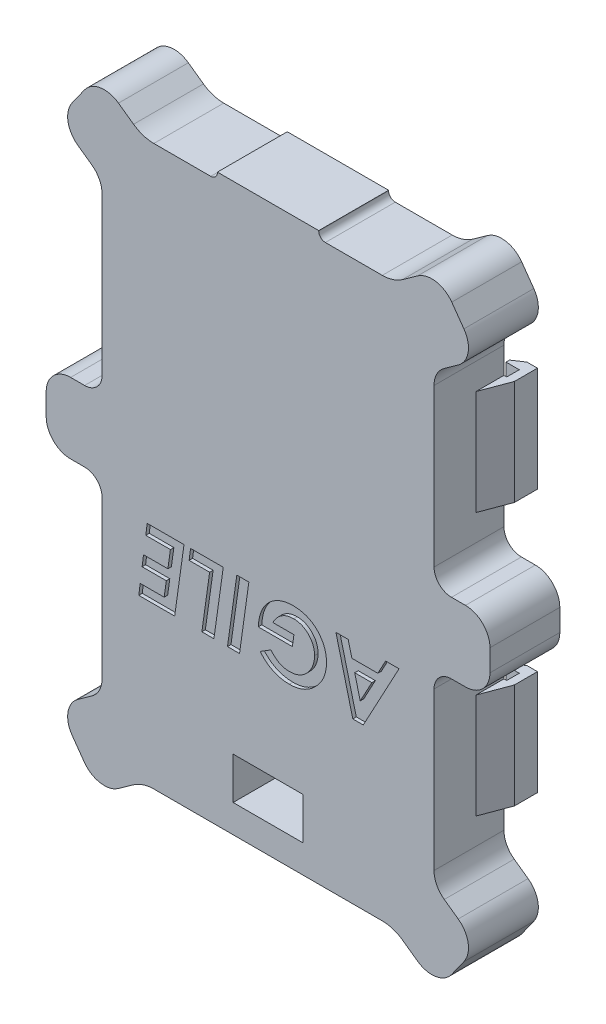
from build123d import *

# Parameters (mm, degrees)
EXTRUDE_3_DEPTH      = 18
SKETCH1_W            = 24
SKETCH1_H            = 15
SKETCH1_W_2          = 20
SKETCH1_H_2          = 12
EXTRUDE_3_2_DEPTH    = 18
SKETCH_1_W           = 20
SKETCH_1_H           = 12
EXTRUDE_4_DEPTH      = 2
SKETCH_2_W           = 24
SKETCH_2_H           = 15
SKETCH_2_W_2         = 20
SKETCH_2_H_2         = 12
CUT_EXTRUDE_1_DEPTH  = 6
SKETCH_3_W           = 34
SKETCH_3_H           = 4.2
CUT_EXTRUDE_2_DEPTH  = 1.5
CUT_EXTRUDE_3_DEPTH  = 1
EXTRUDE_5_DEPTH      = 3
EXTRUDE_6_DEPTH      = 3
EXTRUDE_7_DEPTH      = 3
SKETCH_10_W          = 3
SKETCH_10_H          = 30
EXTRUDE_8_DEPTH      = 3
SKETCH_11_W          = 0.8
SKETCH_11_H          = 3.6
CUT_EXTRUDE_5_DEPTH  = 30
EXTRUDE_9_DEPTH      = 3
SKETCH_14_W          = 3
SKETCH_14_H          = 3
EXTRUDE_10_DEPTH     = 30
EXTRUDE_11_DEPTH     = 3
SKETCH_17_W          = 3
SKETCH_17_H          = 3
EXTRUDE_12_DEPTH     = 30
FILLET_1_R           = 1.5
SKETCH_8_W           = 0.8
SKETCH_8_H           = 3.6
CUT_EXTRUDE_9_DEPTH  = 30
SKETCH_15_W          = 0.8
SKETCH_15_H          = 3.6
CUT_EXTRUDE_10_DEPTH = 30
SKETCH_18_W          = 0.8
SKETCH_18_H          = 3.6
CUT_EXTRUDE_11_DEPTH = 30


with BuildPart() as part:
    # Sketch1 → Бобышка-Вытянуть3 (new body)
    with BuildSketch(Plane.XY):
        with BuildLine():
            ThreePointArc((-18.691989124, 16.827995472), (-21.740151192, 17.303883544), (-24.498196466, 18.686253871))
            Line((-24.498196466, 18.686253871), (-28.812938034, 21.763271713))
            ThreePointArc((-28.812938034, 21.763271713), (-34.033313652, 22.967935089), (-38.576502294, 20.128397731))
            Line((-38.576502294, 20.128397731), (-42.0602267, 15.24335277))
            ThreePointArc((-42.0602267, 15.24335277), (-43.264890076, 10.022977152), (-40.425352718, 5.47978851))
            Line((-40.425352718, 5.47978851), (-36.440527218, 2.638047245))
            ThreePointArc((-36.440527218, 2.638047245), (-34.281914219, 0.144259766), (-33.504872357, -3.061171876))
            Line((-33.504872357, -3.061171876), (-33.504872357, -48.061171876))
            ThreePointArc((-33.504872357, -48.061171876), (-34.969338451, -51.596705782), (-38.504872357, -53.061171876))
            Line((-38.504872357, -53.061171876), (-42.504872357, -53.061171876))
            ThreePointArc((-42.504872357, -53.061171876), (-47.454619825, -55.111424408), (-49.504872357, -60.061171876))
            Line((-49.504872357, -60.061171876), (-49.504872357, -66.28283718))
            ThreePointArc((-49.504872357, -66.28283718), (-47.454619825, -71.232584649), (-42.504872357, -73.28283718))
            Line((-42.504872357, -73.28283718), (-38.504872357, -73.28283718))
            ThreePointArc((-38.504872357, -73.28283718), (-34.969338451, -74.747303275), (-33.504872357, -78.28283718))
            Line((-33.504872357, -78.28283718), (-33.504872357, -123.28283718))
            ThreePointArc((-33.504872357, -123.28283718), (-34.281914219, -126.488268823), (-36.440527218, -128.982056301))
            Line((-36.440527218, -128.982056301), (-40.425352718, -131.823797566))
            ThreePointArc((-40.425352718, -131.823797566), (-43.264890076, -136.366986209), (-42.0602267, -141.587361827))
            Line((-42.0602267, -141.587361827), (-38.576502537, -146.472406448))
            ThreePointArc((-38.576502537, -146.472406448), (-34.033313895, -149.311943805), (-28.812938276, -148.107280429))
            Line((-28.812938276, -148.107280429), (-24.495675072, -145.028464305))
            ThreePointArc((-24.495675072, -145.028464305), (-21.738676476, -143.647420254), (-18.691989124, -143.172004528))
            Line((-18.691989124, -143.172004528), (46.687073776, -143.172004528))
            ThreePointArc((46.687073776, -143.172004528), (49.735235844, -143.647892601), (52.493281118, -145.030262927))
            Line((52.493281118, -145.030262927), (56.808022686, -148.107280769))
            ThreePointArc((56.808022686, -148.107280769), (62.028398304, -149.311944145), (66.571586947, -146.472406787))
            Line((66.571586947, -146.472406787), (70.055311352, -141.587361827))
            ThreePointArc((70.055311352, -141.587361827), (71.259974728, -136.366986209), (68.42043737, -131.823797566))
            Line((68.42043737, -131.823797566), (64.43561187, -128.982056301))
            ThreePointArc((64.43561187, -128.982056301), (62.276998871, -126.488268823), (61.499957009, -123.28283718))
            Line((61.499957009, -123.28283718), (61.499957009, -78.28283718))
            ThreePointArc((61.499957009, -78.28283718), (62.964423103, -74.747303275), (66.499957009, -73.282837181))
            Line((66.499957009, -73.282837181), (70.499957009, -73.282837181))
            ThreePointArc((70.499957009, -73.282837181), (75.449704477, -71.232584649), (77.499957009, -66.282837181))
            Line((77.499957009, -66.282837181), (77.499957009, -60.061171876))
            ThreePointArc((77.499957009, -60.061171876), (75.449704477, -55.111424408), (70.499957009, -53.061171876))
            Line((70.499957009, -53.061171876), (66.499957009, -53.061171876))
            ThreePointArc((66.499957009, -53.061171876), (62.964423103, -51.596705782), (61.499957009, -48.061171876))
            Line((61.499957009, -48.061171876), (61.499957009, -3.061171876))
            ThreePointArc((61.499957009, -3.061171876), (62.276998871, 0.144259766), (64.43561187, 2.638047245))
            Line((64.43561187, 2.638047245), (68.42043737, 5.47978851))
            ThreePointArc((68.42043737, 5.47978851), (71.259974728, 10.022977152), (70.055311352, 15.24335277))
            Line((70.055311352, 15.24335277), (66.571586946, 20.128397731))
            ThreePointArc((66.571586946, 20.128397731), (62.028398304, 22.967935089), (56.808022686, 21.763271712))
            Line((56.808022686, 21.763271712), (52.493281118, 18.68625387))
            ThreePointArc((52.493281118, 18.68625387), (49.735235844, 17.303883544), (46.687073776, 16.827995472))
            Line((46.687073776, 16.827995472), (30.397542326, 16.827995472))
            ThreePointArc((30.397542326, 16.827995472), (29.054039442, 17.384492587), (28.497542326, 18.727995472))
            Line((28.497542326, 18.727995472), (28.497542326, 18.827995472))
            Line((28.497542326, 18.827995472), (-0.502457674, 18.827995472))
            Line((-0.502457674, 18.827995472), (-0.502457674, 18.727995472))
            ThreePointArc((-0.502457674, 18.727995472), (-1.05895479, 17.384492588), (-2.402457674, 16.827995472))
            Line((-2.402457674, 16.827995472), (-18.691989124, 16.827995472))
        make_face()
        with BuildLine():
            ThreePointArc((-38.504872357, -54.561171876), (-33.908678279, -52.657365954), (-32.004872357, -48.061171876))
            Line((-32.004872357, -48.061171876), (-32.004872357, -3.061171876))
            ThreePointArc((-32.004872357, -3.061171876), (-32.948423189, 0.831137975), (-35.569596116, 3.859308485))
            Line((-35.569596116, 3.859308485), (-39.554421617, 6.70104975))
            ThreePointArc((-39.554421617, 6.70104975), (-41.785486683, 10.270697969), (-40.838965459, 14.372421669))
            Line((-40.838965459, 14.372421669), (-37.355241054, 19.25746663))
            ThreePointArc((-37.355241054, 19.25746663), (-33.785592835, 21.488531696), (-29.683869135, 20.542010472))
            Line((-29.683869135, 20.542010472), (-25.369127567, 17.46499263))
            ThreePointArc((-25.369127567, 17.46499263), (-22.197375502, 15.875266755), (-18.691989124, 15.327995472))
            Line((-18.691989124, 15.327995472), (0.997542326, 15.327995472))
            Line((0.997542326, 15.327995472), (0.997542326, 17.327995472))
            Line((0.997542326, 17.327995472), (26.997542326, 17.327995472))
            Line((26.997542326, 17.327995472), (26.997542326, 15.327995472))
            Line((26.997542326, 15.327995472), (46.687073776, 15.327995472))
            ThreePointArc((46.687073776, 15.327995472), (50.192460154, 15.875266755), (53.364212219, 17.46499263))
            Line((53.364212219, 17.46499263), (57.678953788, 20.542010472))
            ThreePointArc((57.678953788, 20.542010472), (61.780677487, 21.488531696), (65.350325706, 19.25746663))
            Line((65.350325706, 19.25746663), (68.834050111, 14.372421669))
            ThreePointArc((68.834050111, 14.372421669), (69.780571336, 10.270697969), (67.549506269, 6.70104975))
            Line((67.549506269, 6.70104975), (63.564680768, 3.859308485))
            ThreePointArc((63.564680768, 3.859308485), (60.943507842, 0.831137975), (59.999957009, -3.061171876))
            Line((59.999957009, -3.061171876), (59.999957009, -48.061171876))
            ThreePointArc((59.999957009, -48.061171876), (61.903762931, -52.657365954), (66.499957009, -54.561171876))
            Line((66.499957009, -54.561171876), (70.499957009, -54.561171876))
            ThreePointArc((70.499957009, -54.561171876), (74.389044306, -56.172084579), (75.999957009, -60.061171876))
            Line((75.999957009, -60.061171876), (75.999957009, -66.282837181))
            ThreePointArc((75.999957009, -66.282837181), (74.389044306, -70.171924477), (70.499957009, -71.782837181))
            Line((70.499957009, -71.782837181), (66.499957009, -71.782837181))
            ThreePointArc((66.499957009, -71.782837181), (61.903762932, -73.686643103), (59.999957009, -78.28283718))
            Line((59.999957009, -78.28283718), (59.999957009, -123.28283718))
            ThreePointArc((59.999957009, -123.28283718), (60.943507842, -127.175147032), (63.564680769, -130.203317542))
            Line((63.564680769, -130.203317542), (67.549506269, -133.045058807))
            ThreePointArc((67.549506269, -133.045058807), (69.780571336, -136.614707025), (68.834050112, -140.716430725))
            Line((68.834050112, -140.716430725), (65.350325706, -145.601475686))
            ThreePointArc((65.350325706, -145.601475686), (61.780677488, -147.832540753), (57.678953788, -146.886019529))
            Line((57.678953788, -146.886019529), (53.364212219, -143.809001687))
            ThreePointArc((53.364212219, -143.809001687), (50.192460155, -142.219275812), (46.687073776, -141.672004528))
            Line((46.687073776, -141.672004528), (-18.695087599, -141.672004528))
            ThreePointArc((-18.695087599, -141.672004528), (-22.19752364, -142.218815196), (-25.366606173, -143.807203065))
            Line((-25.366606173, -143.807203065), (-29.683869378, -146.886019189))
            ThreePointArc((-29.683869378, -146.886019189), (-33.785593078, -147.832540413), (-37.355241297, -145.601475346))
            Line((-37.355241297, -145.601475346), (-40.838965459, -140.716430725))
            ThreePointArc((-40.838965459, -140.716430725), (-41.785486683, -136.614707025), (-39.554421617, -133.045058807))
            Line((-39.554421617, -133.045058807), (-35.569596116, -130.203317542))
            ThreePointArc((-35.569596116, -130.203317542), (-32.948423189, -127.175147032), (-32.004872357, -123.28283718))
            Line((-32.004872357, -123.28283718), (-32.004872357, -78.28283718))
            ThreePointArc((-32.004872357, -78.28283718), (-33.908678279, -73.686643103), (-38.504872357, -71.78283718))
            Line((-38.504872357, -71.78283718), (-42.504872357, -71.78283718))
            ThreePointArc((-42.504872357, -71.78283718), (-46.393959654, -70.171924477), (-48.004872357, -66.28283718))
            Line((-48.004872357, -66.28283718), (-48.004872357, -60.061171876))
            ThreePointArc((-48.004872357, -60.061171876), (-46.393959654, -56.172084579), (-42.504872357, -54.561171876))
            Line((-42.504872357, -54.561171876), (-38.504872357, -54.561171876))
        make_face(mode=Mode.SUBTRACT)
    extrude(amount=EXTRUDE_3_DEPTH)



with BuildPart() as body_2:
    # Sketch1 → Extrude 3 2 (new body)
    with BuildSketch(Plane.XY):
        with Locations((13.997542326, -129.172004528)):
            Rectangle(SKETCH1_W, SKETCH1_H)
        with Locations((13.997542326, -129.172004528)):
            Rectangle(SKETCH1_W_2, SKETCH1_H_2, mode=Mode.SUBTRACT)
    extrude(amount=EXTRUDE_3_2_DEPTH)


with BuildPart() as part_1:
    add(part.part)

    add(body_2.part)  # Бобышка-Вытянуть4 merges body 2
    # Эскиз1 → Бобышка-Вытянуть4 (add)
    with BuildSketch(Plane.XY.offset(18)):
        with BuildLine():
            Line((66.499957009, -53.061171876), (70.499957009, -53.061171876))
            ThreePointArc((70.499957009, -53.061171876), (75.449704477, -55.111424408), (77.499957009, -60.061171876))
            Line((77.499957009, -60.061171876), (77.499957009, -66.282837181))
            ThreePointArc((77.499957009, -66.282837181), (75.449704477, -71.232584649), (70.499957009, -73.282837181))
            Line((70.499957009, -73.282837181), (66.499957009, -73.282837181))
            ThreePointArc((66.499957009, -73.282837181), (62.964423103, -74.747303275), (61.499957009, -78.28283718))
            Line((61.499957009, -78.28283718), (61.499957009, -123.28283718))
            ThreePointArc((61.499957009, -123.28283718), (62.276998871, -126.488268823), (64.43561187, -128.982056301))
            Line((64.43561187, -128.982056301), (68.42043737, -131.823797566))
            ThreePointArc((68.42043737, -131.823797566), (71.259974728, -136.366986209), (70.055311352, -141.587361827))
            Line((70.055311352, -141.587361827), (66.571586947, -146.472406787))
            ThreePointArc((66.571586947, -146.472406787), (62.028398304, -149.311944145), (56.808022686, -148.107280769))
            Line((56.808022686, -148.107280769), (52.493281118, -145.030262927))
            ThreePointArc((52.493281118, -145.030262927), (49.735235844, -143.647892601), (46.687073776, -143.172004528))
            Line((46.687073776, -143.172004528), (-18.691989124, -143.172004528))
            ThreePointArc((-18.691989124, -143.172004528), (-21.738676402, -143.647420483), (-24.495675072, -145.028464305))
            Line((-24.495675072, -145.028464305), (-28.812938276, -148.107280429))
            ThreePointArc((-28.812938276, -148.107280429), (-34.033313895, -149.311943805), (-38.576502537, -146.472406448))
            Line((-38.576502537, -146.472406448), (-42.0602267, -141.587361827))
            ThreePointArc((-42.0602267, -141.587361827), (-43.264890076, -136.366986209), (-40.425352718, -131.823797566))
            Line((-40.425352718, -131.823797566), (-36.440527218, -128.982056301))
            ThreePointArc((-36.440527218, -128.982056301), (-34.281914219, -126.488268823), (-33.504872357, -123.28283718))
            Line((-33.504872357, -123.28283718), (-33.504872357, -78.28283718))
            ThreePointArc((-33.504872357, -78.28283718), (-34.969338451, -74.747303275), (-38.504872357, -73.28283718))
            Line((-38.504872357, -73.28283718), (-42.504872357, -73.28283718))
            ThreePointArc((-42.504872357, -73.28283718), (-47.454619825, -71.232584649), (-49.504872357, -66.28283718))
            Line((-49.504872357, -66.28283718), (-49.504872357, -60.061171876))
            ThreePointArc((-49.504872357, -60.061171876), (-47.454619825, -55.111424407), (-42.504872357, -53.061171876))
            Line((-42.504872357, -53.061171876), (-38.504872357, -53.061171876))
            ThreePointArc((-38.504872357, -53.061171876), (-34.969338451, -51.596705782), (-33.504872357, -48.061171876))
            Line((-33.504872357, -48.061171876), (-33.504872357, -3.061171876))
            ThreePointArc((-33.504872357, -3.061171876), (-34.281914219, 0.144259766), (-36.440527218, 2.638047245))
            Line((-36.440527218, 2.638047245), (-40.425352718, 5.47978851))
            ThreePointArc((-40.425352718, 5.47978851), (-43.264890076, 10.022977152), (-42.0602267, 15.24335277))
            Line((-42.0602267, 15.24335277), (-38.576502294, 20.128397731))
            ThreePointArc((-38.576502294, 20.128397731), (-34.033313652, 22.967935089), (-28.812938034, 21.763271713))
            Line((-28.812938034, 21.763271713), (-24.498196466, 18.686253871))
            ThreePointArc((-24.498196466, 18.686253871), (-21.740151192, 17.303883544), (-18.691989124, 16.827995472))
            Line((-18.691989124, 16.827995472), (-2.402457674, 16.827995472))
            ThreePointArc((-2.402457674, 16.827995472), (-1.05895479, 17.384492588), (-0.502457674, 18.727995472))
            Line((-0.502457674, 18.727995472), (-0.502457674, 18.827995472))
            Line((-0.502457674, 18.827995472), (28.497542326, 18.827995472))
            Line((28.497542326, 18.827995472), (28.497542326, 18.727995472))
            ThreePointArc((28.497542326, 18.727995472), (29.054039442, 17.384492587), (30.397542326, 16.827995472))
            Line((30.397542326, 16.827995472), (46.687073776, 16.827995472))
            ThreePointArc((46.687073776, 16.827995472), (49.735235844, 17.303883544), (52.493281118, 18.68625387))
            Line((52.493281118, 18.68625387), (56.808022686, 21.763271712))
            ThreePointArc((56.808022686, 21.763271712), (62.028398304, 22.967935089), (66.571586946, 20.128397731))
            Line((66.571586946, 20.128397731), (70.055311352, 15.24335277))
            ThreePointArc((70.055311352, 15.24335277), (71.259974728, 10.022977152), (68.42043737, 5.47978851))
            Line((68.42043737, 5.47978851), (64.43561187, 2.638047245))
            ThreePointArc((64.43561187, 2.638047245), (62.276998871, 0.144259766), (61.499957009, -3.061171876))
            Line((61.499957009, -3.061171876), (61.499957009, -48.061171876))
            ThreePointArc((61.499957009, -48.061171876), (62.964423103, -51.596705782), (66.499957009, -53.061171876))
        make_face()
        with Locations((13.997542326, -129.172004528)):
            Rectangle(SKETCH_1_W, SKETCH_1_H, mode=Mode.SUBTRACT)
    extrude(amount=EXTRUDE_4_DEPTH)

    # Эскиз2 → Вырез-Вытянуть1 (cut)
    with BuildSketch(Plane(origin=(0, 0, 0), x_dir=(-1, 0, 0), z_dir=(0, 0, -1))):
        with Locations((-13.997542326, -129.172004528)):
            Rectangle(SKETCH_2_W, SKETCH_2_H)
        with Locations((-13.997542326, -129.172004528)):
            Rectangle(SKETCH_2_W_2, SKETCH_2_H_2, mode=Mode.SUBTRACT)
    extrude(amount=-CUT_EXTRUDE_1_DEPTH, mode=Mode.SUBTRACT)

    # Эскиз3 → Вырез-Вытянуть2 (cut)
    with BuildSketch(Plane.XZ.offset(143.172004528)):
        with BuildLine():
            Line((41.697542326, 0), (44.297542326, 0))
            Line((44.297542326, 0), (44.297542326, 4))
            ThreePointArc((44.297542326, 4), (42.997542326, 5.3), (41.697542326, 4))
            Line((41.697542326, 4), (41.697542326, 0))
        make_face()
        with Locations((13.997542326, 2.1)):
            Rectangle(SKETCH_3_W, SKETCH_3_H)
        with BuildLine():
            Line((-16.302457674, 0), (-13.702457674, 0))
            Line((-13.702457674, 0), (-13.702457674, 4))
            ThreePointArc((-13.702457674, 4), (-15.002457674, 5.3), (-16.302457674, 4))
            Line((-16.302457674, 4), (-16.302457674, 0))
        make_face()
    extrude(amount=-CUT_EXTRUDE_2_DEPTH, mode=Mode.SUBTRACT)

    # Эскиз4 → Вырез-Вытянуть3 (cut)
    # profile 1 of 5: a face of its own
    with BuildSketch(Plane.XY.offset(20)):
        Polygon((41.248353624, -97.33283718), (38.24889449, -97.33283718), (33.41388848, -78.28283718), (36.932337999, -78.28283718), (37.985583191, -82.434760257), (45.411725018, -82.434760257), (47.640330788, -78.28283718), (51.486965403, -78.28283718), align=None)
        Polygon((38.79841372, -85.609760257), (40.370649297, -91.810932132), (43.702109634, -85.609760257), align=None, mode=Mode.SUBTRACT)
    # profile 2 of 5: a face of its own
    with BuildSketch(Plane.XY.offset(20)):
        with BuildLine():
            Line((11.753672134, -93.86018093), (14.78747622, -91.959760257))
            add(Edge.make_bspline(
                [(14.78747622, -91.959760257), (15.002622642, -92.194820131), (15.413630533, -92.643869958), (16.057945828, -93.230010444), (16.691581066, -93.703487483), (17.323988833, -94.070091752), (17.979083518, -94.328765), (18.661562617, -94.511295248), (19.384654769, -94.624962111), (19.88028251, -94.639077457), (20.133840403, -94.646298719)],
                knots=[0, 0, 0, 0, 1.232795656, 2.355087944, 3.365310555, 4.289182895, 5.175021555, 6.082617246, 7.019087331, 8, 8, 8, 8], degree=3))
            add(Edge.make_bspline(
                [(20.133840403, -94.646298719), (20.409181947, -94.63901852), (20.950325929, -94.624710342), (21.739448505, -94.488728453), (22.493469069, -94.281623562), (23.203289409, -93.977240745), (23.876342819, -93.591274537), (24.506734687, -93.118788722), (25.100361892, -92.56241), (25.450381269, -92.13814562), (25.629032711, -91.9215992)],
                knots=[0, 0, 0, 0, 1.037141059, 2.038350744, 3.009929982, 3.97898528, 4.94136134, 5.928251596, 6.942570427, 8, 8, 8, 8], degree=3))
            add(Edge.make_bspline(
                [(25.629032711, -91.9215992), (25.762807881, -91.740343311), (26.027465363, -91.381751154), (26.372181661, -90.816226495), (26.657175235, -90.233275106), (26.898296325, -89.639087235), (27.078690033, -89.027425432), (27.216049704, -88.401903191), (27.291470337, -87.760090196), (27.302548379, -87.327186361), (27.308119249, -87.109489825)],
                knots=[0, 0, 0, 0, 1.040839251, 2.059170575, 3.055630366, 4.037062373, 5.019110465, 5.999220985, 6.993858158, 8, 8, 8, 8], degree=3))
            add(Edge.make_bspline(
                [(27.308119249, -87.109489825), (27.302980596, -86.896840033), (27.292850332, -86.477625362), (27.213042378, -85.862229908), (27.072406359, -85.274528816), (26.88799801, -84.710057118), (26.641050977, -84.173930724), (26.342144499, -83.663737085), (25.988829893, -83.180858264), (25.585508516, -82.729318934), (25.144204649, -82.31706136), (24.673053187, -81.955722352), (24.176650074, -81.651579578), (23.654796267, -81.402529233), (23.107816566, -81.206503573), (22.534369827, -81.07056015), (21.937744278, -80.983087618), (21.530846465, -80.973990006), (21.324465403, -80.969375642)],
                knots=[0, 0, 0, 0, 1.066897471, 2.103265977, 3.106535126, 4.095591644, 5.078159493, 6.062322472, 7.058152725, 8.075375883, 9.096057735, 10.084186963, 11.049730852, 12.011871914, 12.980953841, 13.959387168, 14.96498868, 16, 16, 16, 16], degree=3))
            add(Edge.make_bspline(
                [(21.324465403, -80.969375642), (21.169164632, -80.972252968), (20.861695484, -80.977949584), (20.406431839, -81.025081007), (19.961500019, -81.101634192), (19.527491722, -81.207424503), (19.104452871, -81.34652508), (18.69149151, -81.515134646), (18.287468854, -81.712147524), (17.896886084, -81.943366374), (17.51911749, -82.201355494), (17.159503567, -82.492571715), (16.818850395, -82.81521008), (16.494427195, -83.167571388), (16.184114992, -83.547776846), (15.898980095, -83.963769893), (15.626289495, -84.40637081), (15.462386025, -84.718314314), (15.378972615, -84.87706795)],
                knots=[0, 0, 0, 0, 0.990751711, 1.961520103, 2.916931976, 3.869720035, 4.809138875, 5.755683625, 6.713987145, 7.674487982, 8.649319602, 9.630449541, 10.623757948, 11.640402946, 12.684918653, 13.752145235, 14.856026455, 16, 16, 16, 16], degree=3))
            Line((15.378972615, -84.87706795), (21.393155307, -84.87706795))
            Line((21.393155307, -84.87706795), (20.958119249, -88.05206795))
            Line((20.958119249, -88.05206795), (11.18888848, -88.05206795))
            add(Edge.make_bspline(
                [(11.18888848, -88.05206795), (11.21334102, -87.668597294), (11.261158972, -86.918704581), (11.433863293, -85.826669635), (11.691096037, -84.796017185), (12.020328844, -83.823346905), (12.434538068, -82.913025459), (12.930049006, -82.064602458), (13.502956604, -81.274878759), (14.156679212, -80.554640138), (14.87265734, -79.908581616), (15.637064858, -79.337159512), (16.4575064, -78.865240479), (17.317372334, -78.466939346), (18.229948346, -78.166656028), (19.187933039, -77.949003896), (20.19500547, -77.816612568), (20.88266618, -77.801879114), (21.232878865, -77.794375642)],
                knots=[0, 0, 0, 0, 1.148919443, 2.246759443, 3.301556394, 4.323129335, 5.314115159, 6.287776434, 7.257369935, 8.227157527, 9.191570884, 10.138257605, 11.076040265, 12.017589954, 12.968137885, 13.943782171, 14.952806877, 16, 16, 16, 16], degree=3))
            add(Edge.make_bspline(
                [(21.232878865, -77.794375642), (21.425015509, -77.796281167), (21.804594393, -77.80004566), (22.365084917, -77.838707225), (22.909817904, -77.904736468), (23.438490191, -77.991388318), (23.953290756, -78.102423869), (24.452088277, -78.238141107), (24.93482356, -78.405196081), (25.404100858, -78.589457479), (25.856181185, -78.804647336), (26.290889666, -79.046002158), (26.712727005, -79.308949515), (27.116461671, -79.600254804), (27.50765843, -79.91331378), (27.880530908, -80.252826332), (28.238303924, -80.617530588), (28.461956926, -80.876544146), (28.575066365, -81.0075367)],
                knots=[0, 0, 0, 0, 1.111462715, 2.195769474, 3.248241993, 4.285083826, 5.294049813, 6.293849075, 7.273621873, 8.247990324, 9.209208046, 10.167745722, 11.123340834, 12.083205362, 13.046336853, 14.020566337, 14.998928573, 16, 16, 16, 16], degree=3))
            add(Edge.make_bspline(
                [(28.575066365, -81.0075367), (28.746986778, -81.224681012), (29.08832791, -81.655812392), (29.526733887, -82.350402676), (29.899475499, -83.074071186), (30.201698692, -83.831013257), (30.43864828, -84.617472804), (30.606747524, -85.436009415), (30.707100327, -86.283968792), (30.720544098, -86.859900878), (30.727350018, -87.151466988)],
                knots=[0, 0, 0, 0, 0.999311991, 1.984094138, 2.959667686, 3.934376172, 4.922301283, 5.921106662, 6.947558471, 8, 8, 8, 8], degree=3))
            add(Edge.make_bspline(
                [(30.727350018, -87.151466988), (30.718190249, -87.508186162), (30.700115782, -88.212080454), (30.545409243, -89.247211815), (30.302122207, -90.246107625), (29.958021211, -91.209198057), (29.50751607, -92.131898211), (28.961269735, -93.017471999), (28.321749603, -93.869761962), (27.586218276, -94.667460102), (26.78836619, -95.40460714), (25.94122509, -96.05213736), (25.052901754, -96.59717642), (24.130660183, -97.048534589), (23.165692934, -97.391718911), (22.16648255, -97.640093968), (21.128255943, -97.794005904), (20.423123915, -97.812108565), (20.065150499, -97.821298719)],
                knots=[0, 0, 0, 0, 1.022497491, 2.017637963, 2.994389496, 3.967079589, 4.944335062, 5.93346684, 6.946839843, 7.995112064, 9.040696054, 10.058471571, 11.04760335, 12.024858823, 12.997548916, 13.978718102, 14.973858573, 16, 16, 16, 16], degree=3))
            add(Edge.make_bspline(
                [(20.065150499, -97.821298719), (19.796560881, -97.814781084), (19.261914722, -97.801807283), (18.464198305, -97.717201953), (17.678150215, -97.570120654), (16.904839079, -97.373474094), (16.157526165, -97.123115579), (15.441754776, -96.82372092), (14.764832788, -96.477193176), (14.116998566, -96.083796191), (13.498135241, -95.628890759), (12.897107081, -95.105822011), (12.309366322, -94.514964082), (11.94157168, -94.081585904), (11.753672134, -93.86018093)],
                knots=[0, 0, 0, 0, 1.014161743, 2.018758889, 3.024870469, 4.031360302, 5.029241203, 5.997972455, 6.958152657, 7.898032929, 8.856770515, 9.854420212, 10.903862582, 12, 12, 12, 12], degree=3))
        make_face()
    # profile 3 of 5: a face of its own
    with BuildSketch(Plane.XY.offset(20)):
        Polygon((5.83107598, -97.33283718), (2.381316365, -97.33283718), (5.052590403, -78.28283718), (8.502350018, -78.28283718), align=None)
    # profile 4 of 5: a face of its own
    with BuildSketch(Plane.XY.offset(20)):
        Polygon((-1.495847097, -97.33283718), (-4.949422818, -97.33283718), (-2.720817049, -81.45783718), (-8.593803828, -81.45783718), (-8.181664405, -78.28283718), (1.175426941, -78.28283718), align=None)
    # profile 5 of 5: a face of its own
    with BuildSketch(Plane.XY.offset(20)):
        Polygon((-12.730462482, -97.33283718), (-23.003419212, -97.33283718), (-22.602728107, -94.15783718), (-15.737553828, -94.15783718), (-15.119344693, -89.761683334), (-22.04939277, -89.761683334), (-21.644885559, -86.586683334), (-14.672860318, -86.586683334), (-13.955432434, -81.45783718), (-20.999963684, -81.45783718), (-20.599272578, -78.28283718), (-10.059188443, -78.28283718), align=None)
    extrude(amount=-CUT_EXTRUDE_3_DEPTH, mode=Mode.SUBTRACT)

    # Эскиз5 → Бобышка-Вытянуть5 (add)
    with BuildSketch(Plane.ZY.offset(33.504872357)):
        Polygon((8, -10.561171876), (-3.2, -10.561171876), (-6.6, -10.561171876), (-6.6, -40.561171876), (-3.2, -40.561171876), (8, -40.561171876), align=None)
    extrude(amount=EXTRUDE_5_DEPTH)

    # Эскиз7 → Бобышка-Вытянуть6 (add)
    with BuildSketch(Plane(origin=(-33.504872357, 0, 0), x_dir=(0, 0, -1), z_dir=(1, 0, 0))):
        Polygon((3.6, -10.561171876), (6.6, -10.561171876), (6.6, -40.561171876), (4.7, -40.561171876), (3.6, -40.561171876), align=None)
    extrude(amount=EXTRUDE_6_DEPTH)



with BuildPart() as body_2_2:
    # Эскиз9 → Бобышка-Вытянуть7 (new body)
    with BuildSketch(Plane.ZY.offset(33.504872357)):
        Polygon((0, -115.78283718), (8, -115.78283718), (8, -85.78283718), (0, -85.78283718), (-6.6, -85.78283718), (-6.6, -115.78283718), align=None)
    extrude(amount=EXTRUDE_7_DEPTH)


with BuildPart() as part_2:
    add(part_1.part)

    add(body_2_2.part)  # Бобышка-Вытянуть8 merges body 2 2
    # Эскиз10 → Бобышка-Вытянуть8 (add)
    with BuildSketch(Plane(origin=(-33.504872357, 0, 0), x_dir=(0, 0, -1), z_dir=(1, 0, 0))):
        with Locations((5.1, -100.78283718)):
            Rectangle(SKETCH_10_W, SKETCH_10_H)
    extrude(amount=EXTRUDE_8_DEPTH)

    # Эскиз11 → Вырез-Вытянуть5 (cut)
    with BuildSketch(Plane.XZ.offset(115.78283718)):
        Polygon((-33.504872357, 8), (-36.504872357, 0), (-36.504872357, 8), align=None)
        Polygon((-33.504872357, -6.6), (-30.504872357, -4.6), (-30.504872357, -6.6), align=None)
        with Locations((-33.904872357, -1.8)):
            Rectangle(SKETCH_11_W, SKETCH_11_H)
    extrude(amount=-CUT_EXTRUDE_5_DEPTH, mode=Mode.SUBTRACT)

    # Эскиз12 → Бобышка-Вытянуть9 (add)
    with BuildSketch(Plane(origin=(61.499957009, 0, 0), x_dir=(0, 0, -1), z_dir=(1, 0, 0))):
        Polygon((0, -115.78283718), (-8, -115.78283718), (-8, -85.78283718), (6.6, -85.78283718), (6.6, -115.78283718), align=None)
    extrude(amount=EXTRUDE_9_DEPTH)

    # Эскиз14 → Бобышка-Вытянуть10 (add)
    with BuildSketch(Plane.XZ.offset(115.78283718)):
        with Locations((59.999957009, -5.1)):
            Rectangle(SKETCH_14_W, SKETCH_14_H)
    extrude(amount=-EXTRUDE_10_DEPTH)

    # Эскиз16 → Бобышка-Вытянуть11 (add)
    with BuildSketch(Plane(origin=(61.499957009, 0, 0), x_dir=(0, 0, -1), z_dir=(1, 0, 0))):
        Polygon((0, -40.561171876), (-8, -40.561171876), (-8, -10.561171876), (0, -10.561171876), (6.6, -10.561171876), (6.6, -40.561171876), align=None)
    extrude(amount=EXTRUDE_11_DEPTH)

    # Эскиз17 → Бобышка-Вытянуть12 (add)
    with BuildSketch(Plane(origin=(0, -10.561171876, 0), x_dir=(1, 0, 0), z_dir=(0, 1, 0))):
        with Locations((59.999957009, 5.1)):
            Rectangle(SKETCH_17_W, SKETCH_17_H)
    extrude(amount=-EXTRUDE_12_DEPTH)

    # Скругление1
    fillet_1_edges = [part_2.edges().sort_by_distance(p)[0] for p in [
        (13.997542326, -135.172004528, 6),
        (3.997542326, -129.172004528, 6),
        (13.997542326, -123.172004528, 6),
        (23.997542326, -129.172004528, 6),
    ]]
    fillet(fillet_1_edges, radius=FILLET_1_R - 0.0001)  # a hair under: the kernel refuses the full size

    # Эскиз8 → Вырез-Вытянуть9 (cut)
    with BuildSketch(Plane(origin=(0, -10.561171876, 0), x_dir=(1, 0, 0), z_dir=(0, 1, 0))):
        Polygon((-36.504872357, 0), (-33.504872357, -8), (-36.504872357, -8), align=None)
        Polygon((-30.504872357, 6.6), (-30.504872357, 4.6), (-33.504872357, 6.6), align=None)
        with Locations((-33.904872357, 1.8)):
            Rectangle(SKETCH_8_W, SKETCH_8_H)
    extrude(amount=-CUT_EXTRUDE_9_DEPTH, mode=Mode.SUBTRACT)

    # Эскиз15 → Вырез-Вытянуть10 (cut)
    with BuildSketch(Plane.XZ.offset(115.78283718)):
        Polygon((61.499957009, 8), (64.499957009, 0), (64.499957009, 8), align=None)
        Polygon((58.499957009, -4.6), (61.499957009, -6.6), (58.499957009, -6.6), align=None)
        with Locations((61.899957009, -1.8)):
            Rectangle(SKETCH_15_W, SKETCH_15_H)
    extrude(amount=-CUT_EXTRUDE_10_DEPTH, mode=Mode.SUBTRACT)

    # Эскиз18 → Вырез-Вытянуть11 (cut)
    with BuildSketch(Plane(origin=(0, -10.561171876, 0), x_dir=(1, 0, 0), z_dir=(0, 1, 0))):
        with Locations((61.899957009, 1.8)):
            Rectangle(SKETCH_18_W, SKETCH_18_H)
        Polygon((64.499957009, 0), (61.499957009, -8), (64.499957009, -8), align=None)
        Polygon((58.499957009, 4.6), (61.499957009, 6.6), (58.499957009, 6.6), align=None)
    extrude(amount=-CUT_EXTRUDE_11_DEPTH, mode=Mode.SUBTRACT)


solid = part_2.part
